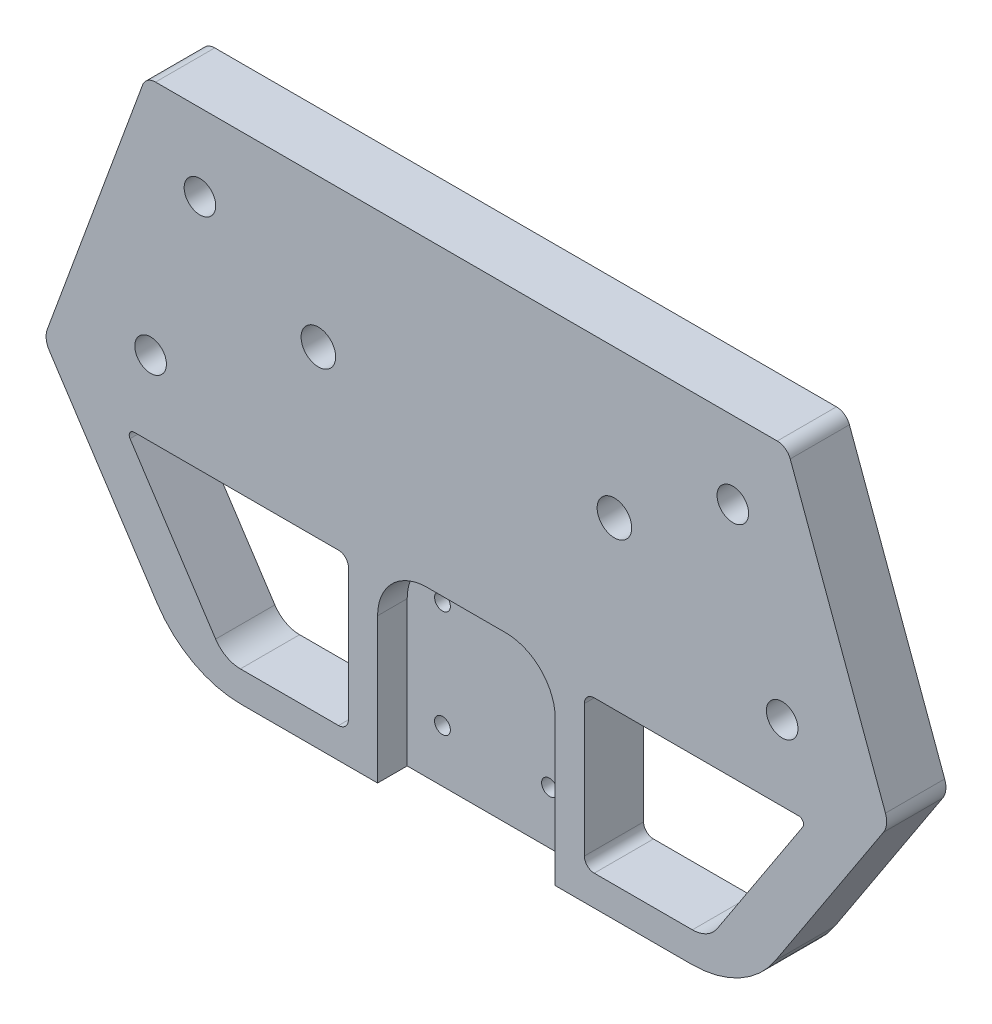
from build123d import *

# Parameters (mm, degrees)
SKETCH2_R               = 2.2225
BOSS_EXTRUDE1_DEPTH     = 7.62
CUT_EXTRUDE1_DEPTH      = 65.443482206
CUT_EXTRUDE1_DEPTH_BACK = 65.443482206
SKETCH3_R               = 1.016
CUT_EXTRUDE2_DEPTH      = 65.443482206
CUT_EXTRUDE2_DEPTH_BACK = 3.81
SKETCH5_R               = 1.905
CUT_EXTRUDE3_DEPTH      = 1.3335
CUT_EXTRUDE4_DEPTH      = 65.443482206
SKETCH8_R               = 2.032
CUT_EXTRUDE6_DEPTH      = 65.443482206
SKETCH9_R               = 3.937
CUT_EXTRUDE7_DEPTH      = 2.286


with BuildPart() as part:
    # Sketch2 → Boss-Extrude1 (new body)
    with BuildSketch(Plane.XY):
        with BuildLine():
            Line((-53.9331315, -0.315391151), (-41.673792668, 33.030010472))
            ThreePointArc((-41.673792668, 33.030010472), (-41.022456018, 33.874587748), (-40.005, 34.194483756))
            Line((-40.005, 34.194483756), (40.005, 34.194483756))
            ThreePointArc((40.005, 34.194483756), (41.022456018, 33.874587748), (41.673792668, 33.030010472))
            Line((41.673792668, 33.030010472), (53.9331315, -0.315391151))
            ThreePointArc((53.9331315, -0.315391151), (54.072783991, -1.479661595), (53.674573059, -2.582592481))
            Line((53.674573059, -2.582592481), (39.780650937, -23.816388011))
            ThreePointArc((39.780650937, -23.816388011), (35.127277075, -28.095614939), (28.998611748, -29.64646397))
            Line((28.998611748, -29.64646397), (-28.998611748, -29.64646397))
            ThreePointArc((-28.998611748, -29.64646397), (-35.127277075, -28.095614939), (-39.780650937, -23.816388011))
            Line((-39.780650937, -23.816388011), (-53.674573059, -2.582592481))
            ThreePointArc((-53.674573059, -2.582592481), (-54.072783991, -1.479661595), (-53.9331315, -0.315391151))
        make_face()
        with Locations((-19.05, 15.144483756)):
            Circle(SKETCH2_R, mode=Mode.SUBTRACT)
        with Locations((19.05, 15.144483756)):
            Circle(SKETCH2_R, mode=Mode.SUBTRACT)
    extrude(amount=BOSS_EXTRUDE1_DEPTH)

    # Sketch3 → Cut-Extrude1 (cut, two sides: drawn at the far end of the back side and taken through both)
    with BuildSketch(Plane.XY.offset(7.62).offset(-CUT_EXTRUDE1_DEPTH_BACK)):
        with Locations((-6.886956, -22.863063209)):
            Circle(SKETCH3_R)
        with Locations((-6.886956, -9.089151209)):
            Circle(SKETCH3_R)
        with Locations((6.886956, -9.089151209)):
            Circle(SKETCH3_R)
        with Locations((6.886956, -22.863063209)):
            Circle(SKETCH3_R)
    extrude(amount=CUT_EXTRUDE1_DEPTH + CUT_EXTRUDE1_DEPTH_BACK, mode=Mode.SUBTRACT)

    # Sketch4 → Cut-Extrude2 (cut, two sides: drawn at the far end of the back side and taken through both)
    with BuildSketch(Plane.XY.offset(7.62).offset(-CUT_EXTRUDE2_DEPTH_BACK)):
        with BuildLine():
            Line((-11.43, -37.721319138), (11.43, -37.721319138))
            Line((11.43, -37.721319138), (11.43, -10.999161163))
            ThreePointArc((11.43, -10.999161163), (9.570128061, -6.509033102), (5.08, -4.649161163))
            Line((5.08, -4.649161163), (-5.08, -4.649161163))
            ThreePointArc((-5.08, -4.649161163), (-9.570128061, -6.509033102), (-11.43, -10.999161163))
            Line((-11.43, -10.999161163), (-11.43, -37.721319138))
        make_face()
    extrude(amount=CUT_EXTRUDE2_DEPTH + CUT_EXTRUDE2_DEPTH_BACK, mode=Mode.SUBTRACT)

    # Sketch5 → Cut-Extrude3 (cut)
    with BuildSketch(Plane(origin=(0, 0, 0), x_dir=(-1, 0, 0), z_dir=(0, 0, -1))):
        with Locations((-6.886956, -9.089151209)):
            Circle(SKETCH5_R)
        with Locations((-6.886956, -22.863063209)):
            Circle(SKETCH5_R)
        with Locations((6.886956, -22.863063209)):
            Circle(SKETCH5_R)
        with Locations((6.886956, -9.089151209)):
            Circle(SKETCH5_R)
    extrude(amount=-CUT_EXTRUDE3_DEPTH, mode=Mode.SUBTRACT)

    # Sketch6 → Cut-Extrude4 (cut, through all)
    with BuildSketch(Plane.XY.offset(7.62)):
        with BuildLine():
            Line((-43.288518763, -7.189330581), (-32.273407011, -24.02349941))
            ThreePointArc((-32.273407011, -24.02349941), (-30.897448537, -25.288826187), (-29.085260384, -25.747397522))
            Line((-29.085260384, -25.747397522), (-16.452977044, -25.747397522))
            ThreePointArc((-16.452977044, -25.747397522), (-15.554951432, -25.375423134), (-15.182977044, -24.477397522))
            Line((-15.182977044, -24.477397522), (-15.182977044, -7.476646933))
            ThreePointArc((-15.182977044, -7.476646933), (-15.554951432, -6.578621321), (-16.452977044, -6.206646933))
            Line((-16.452977044, -6.206646933), (-42.757160992, -6.206646933))
            ThreePointArc((-42.757160992, -6.206646933), (-43.315732436, -6.539615574), (-43.288518763, -7.189330581))
        make_face()
        with BuildLine():
            Line((43.288518763, -7.189330581), (32.273407011, -24.02349941))
            ThreePointArc((32.273407011, -24.02349941), (30.897448537, -25.288826187), (29.085260384, -25.747397522))
            Line((29.085260384, -25.747397522), (16.452977044, -25.747397522))
            ThreePointArc((16.452977044, -25.747397522), (15.554951432, -25.375423134), (15.182977044, -24.477397522))
            Line((15.182977044, -24.477397522), (15.182977044, -7.476646933))
            ThreePointArc((15.182977044, -7.476646933), (15.554951432, -6.578621321), (16.452977044, -6.206646933))
            Line((16.452977044, -6.206646933), (42.757160992, -6.206646933))
            ThreePointArc((42.757160992, -6.206646933), (43.315732436, -6.539615574), (43.288518763, -7.189330581))
        make_face()
    extrude(amount=-CUT_EXTRUDE4_DEPTH, mode=Mode.SUBTRACT)

    # Sketch8 → Cut-Extrude6 (cut, through all)
    with BuildSketch(Plane.XY.offset(7.62)):
        with Locations((-40.64, 3.445353067)):
            Circle(SKETCH8_R)
        with Locations((-34.29, 24.273353067)):
            Circle(SKETCH8_R)
        with Locations((40.64, 3.445353067)):
            Circle(SKETCH8_R)
        with Locations((34.29, 24.273353067)):
            Circle(SKETCH8_R)
    extrude(amount=-CUT_EXTRUDE6_DEPTH, mode=Mode.SUBTRACT)

    # Sketch9 → Cut-Extrude7 (cut)
    with BuildSketch(Plane(origin=(0, 0, 0), x_dir=(-1, 0, 0), z_dir=(0, 0, -1))):
        with Locations((-19.05, 15.144483756)):
            Circle(SKETCH9_R)
        with Locations((19.05, 15.144483756)):
            Circle(SKETCH9_R)
    extrude(amount=-CUT_EXTRUDE7_DEPTH, mode=Mode.SUBTRACT)


solid = part.part
